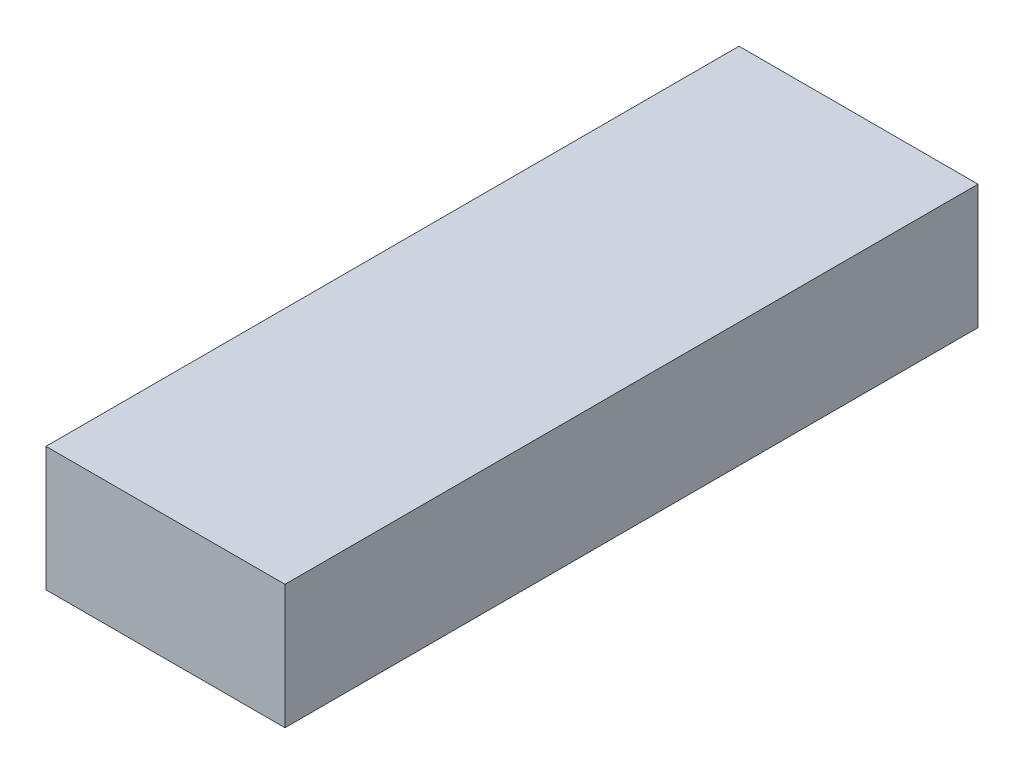
from build123d import *

# Parameters (mm, degrees)
CROQUIS1_W              = 50
CROQUIS1_H              = 26
SALIENTE_EXTRUIR1_DEPTH = 145


with BuildPart() as part:
    # Croquis1 → Saliente-Extruir1 (new body)
    with BuildSketch(Plane.XY):
        with Locations((-30, -13)):
            Rectangle(CROQUIS1_W, CROQUIS1_H)
    extrude(amount=SALIENTE_EXTRUIR1_DEPTH)


solid = part.part
